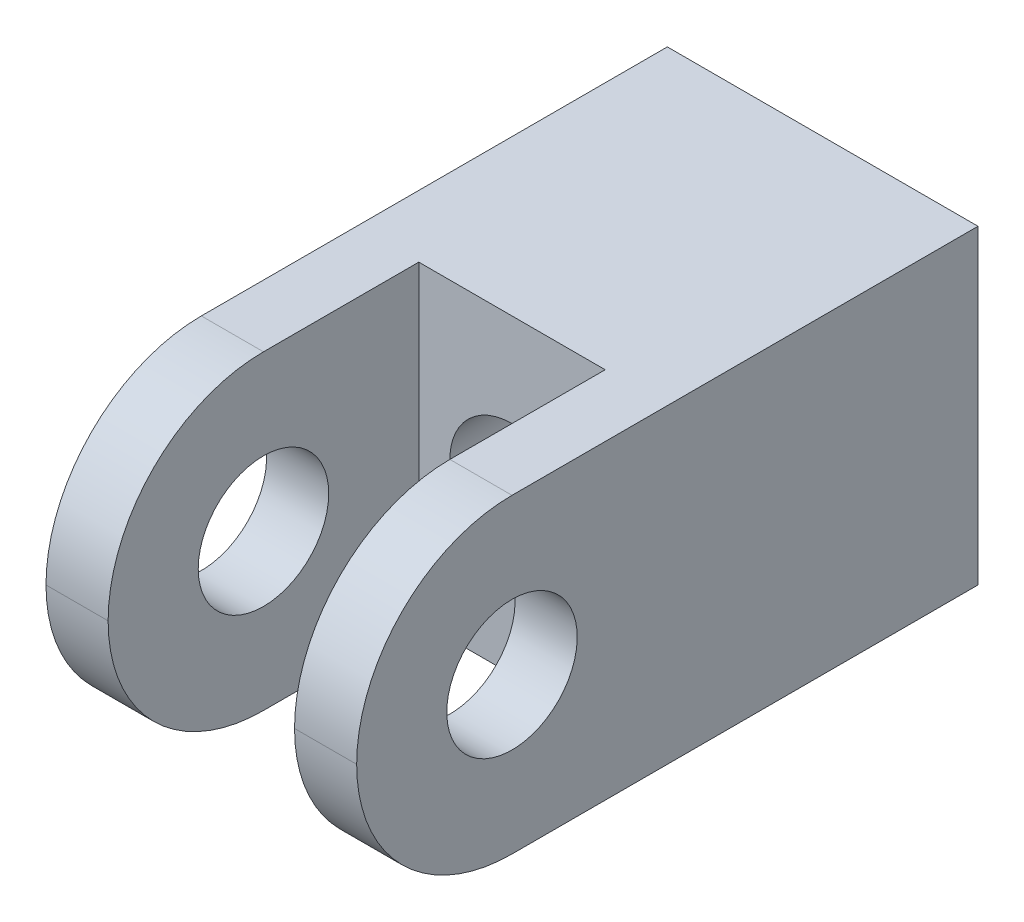
from build123d import *

# Parameters (mm, degrees)
SKETCH_1_W          = 10
SKETCH_1_H          = 10
SKETCH_1_R          = 2
EXTRUDE_1_DEPTH     = 10
SKETCH_2_W          = 2
SKETCH_2_H          = 10
EXTRUDE_2_DEPTH     = 10
SKETCH_3_R          = 2.1
CUT_EXTRUDE_1_DEPTH = 10
FILLET_1_R          = 5


with BuildPart() as part:
    # ｽｹｯﾁ1 → ﾎﾞｽ - 押し出し1 (new body)
    with BuildSketch(Plane.XY):
        Rectangle(SKETCH_1_W, SKETCH_1_H)
        Circle(SKETCH_1_R, mode=Mode.SUBTRACT)
    extrude(amount=EXTRUDE_1_DEPTH)

    # ｽｹｯﾁ2 → ﾎﾞｽ - 押し出し2 (add)
    with BuildSketch(Plane.XY.offset(10)):
        with Locations((-4, 0)):
            Rectangle(SKETCH_2_W, SKETCH_2_H)
        with Locations((4, 0)):
            Rectangle(SKETCH_2_W, SKETCH_2_H)
    extrude(amount=EXTRUDE_2_DEPTH)

    # ｽｹｯﾁ3 → ｶｯﾄ - 押し出し1 (cut)
    with BuildSketch(Plane(origin=(5, 0, 0), x_dir=(0, 0, -1), z_dir=(1, 0, 0))):
        with Locations(Location((-15, 0, 0), (0, 0, 90))):
            Circle(SKETCH_3_R)
    extrude(amount=-CUT_EXTRUDE_1_DEPTH, mode=Mode.SUBTRACT)

    # ﾌｨﾚｯﾄ1
    fillet_1_edges = [part.edges().sort_by_distance(p)[0] for p in [
        (4, -5, 20),
        (4, 5, 20),
        (-4, 5, 20),
        (-4, -5, 20),
    ]]
    fillet(fillet_1_edges, radius=FILLET_1_R - 0.0001)  # a hair under: the kernel refuses the full size


solid = part.part
